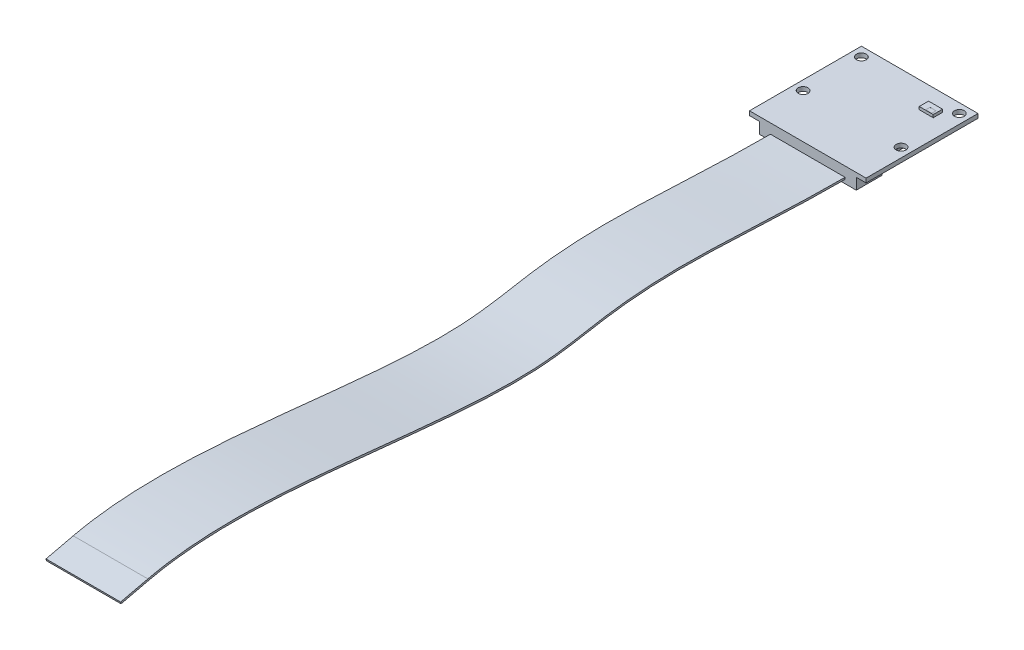
from build123d import *

# Parameters (mm, degrees)
SKIZZE1_W                                 = 25
SKIZZE1_H                                 = 24
PCB_DEPTH                                 = 0.9
SKIZZE2_R                                 = 1.05
MOUNTING_HOLES_DEPTH                      = 20.165333287
SKIZZE3_W                                 = 20.8
SKIZZE3_H                                 = 5.5
CONNECTOR_CLOSED_DEPTH                    = 2.4
SKIZZE4_W                                 = 17.7
SKIZZE4_H                                 = 11.6
COMPONENTS_WORST_CASE_BOUNDARY_BOX_DEPTH  = 1.3
CABLE_156MM_FREE_LENGTH_START             = -8
CABLE_156MM_FREE_LENGTH_DEPTH             = 16
SKIZZE7_W                                 = 3
SKIZZE7_H                                 = 2
COMPONENTS_WORST_CASE_BOUNDARY_BOX2_DEPTH = 0.6
SKIZZE8_W                                 = 1.3
SKIZZE8_H                                 = 0.9
STATUS_LED_DEPTH                          = 0.01


# Read off the part's stored shape, not the designer's step: Cable_156mm_free_Length
with BuildPart() as part:
    # Skizze1 → PCB (new body)
    with BuildSketch(Plane(origin=(0, 0, 0), x_dir=(1, 0, 0), z_dir=(0, 1, 0))):
        with Locations((0, 2.5)):
            Rectangle(SKIZZE1_W, SKIZZE1_H)
    extrude(amount=-PCB_DEPTH)

    # Skizze2 → Mounting_Holes (cut, through all)
    with BuildSketch(Plane(origin=(0, 0, 0), x_dir=(1, 0, 0), z_dir=(0, 1, 0))):
        with Locations(Location((10.5, 12.5, 0), (0, 0, 270))):
            Circle(SKIZZE2_R)
        with Locations(Location((10.5, 0, 0), (0, 0, 270))):
            Circle(SKIZZE2_R)
        with Locations(Location((-10.5, 0, 0), (0, 0, 90))):
            Circle(SKIZZE2_R)
        with Locations(Location((-10.5, 12.5, 0), (0, 0, 90))):
            Circle(SKIZZE2_R)
    extrude(amount=-MOUNTING_HOLES_DEPTH, mode=Mode.SUBTRACT)

    # Skizze3 → Connector_closed (add)
    with BuildSketch(Plane.XZ.offset(0.9)):
        with Locations((0, 6.75)):
            Rectangle(SKIZZE3_W, SKIZZE3_H)
    extrude(amount=CONNECTOR_CLOSED_DEPTH)

    # Skizze4 → Components_worst-case_Boundary-Box (add)
    with BuildSketch(Plane.XZ.offset(0.9)):
        with Locations((-0.15, -6.7)):
            Rectangle(SKIZZE4_W, SKIZZE4_H)
    extrude(amount=COMPONENTS_WORST_CASE_BOUNDARY_BOX_DEPTH)

    # Cable_156mm_free_Length outline → Cable_156mm_free_Length (add)
    with BuildSketch(Plane.YZ.offset(CABLE_156MM_FREE_LENGTH_START)):
        with BuildLine():
            Line((-2.5, 9.5), (-2.1, 9.5))
            add(Edge.make_bspline(
                [(-2.1, 9.5), (-2.1, 16.284815739), (-1.542597815, 28.672571608), (-0.767871914, 45.047531217), (-1.405761964, 55.810551618), (-2.899720501, 65.122898913), (-4.187322625, 71.06018132), (-4.69330723, 85.363066888), (-2.708541026, 105.716134493), (0.417197285, 134.281531699), (-0.187804243, 151.576946245), (-1.925870548, 158.99715239)],
                knots=[0, 0, 0, 0, 0.14, 0.28, 0.414692015, 0.42, 0.514692015, 0.56, 0.706666667, 0.853333333, 1, 1, 1, 1], degree=3))
            Line((-1.925870548, 158.99715239), (-3.294238956, 164.839032901))
            Line((-3.294238956, 164.839032901), (-3.683697656, 164.74780834))
            Line((-3.683697656, 164.74780834), (-2.315329248, 158.90592783))
            add(Edge.make_bspline(
                [(-2.5, 9.5), (-2.499566107, 16.292649524), (-1.941296137, 28.696072965), (-1.170483644, 45.064108744), (-1.800539524, 55.747874351), (-3.294456698, 65.057110496), (-4.585110639, 71.02212801), (-5.095077294, 85.386591273), (-3.103544862, 105.7653373), (0.013809133, 134.316434074), (-0.581906094, 151.527763996), (-2.315329248, 158.90592783)],
                knots=[0, 0, 0, 0, 0.14, 0.28, 0.414692015, 0.42, 0.514692015, 0.56, 0.706666667, 0.853333333, 1, 1, 1, 1], degree=3))
        make_face()
    extrude(amount=CABLE_156MM_FREE_LENGTH_DEPTH)

    # Skizze7 → Components_worst-case_Boundary-Box2 (add)
    with BuildSketch(Plane(origin=(0, 0, 0), x_dir=(1, 0, 0), z_dir=(0, 1, 0))):
        with Locations((7, 9.9)):
            Rectangle(SKIZZE7_W, SKIZZE7_H)
    extrude(amount=COMPONENTS_WORST_CASE_BOUNDARY_BOX2_DEPTH)

    # Skizze8 → Status_LED (cut)
    with BuildSketch(Plane(origin=(0, 0.6, 0), x_dir=(1, 0, 0), z_dir=(0, 1, 0))):
        with Locations((7.45, 9.45)):
            Rectangle(SKIZZE8_W, SKIZZE8_H)
    extrude(amount=-STATUS_LED_DEPTH, mode=Mode.SUBTRACT)


solid = part.part
